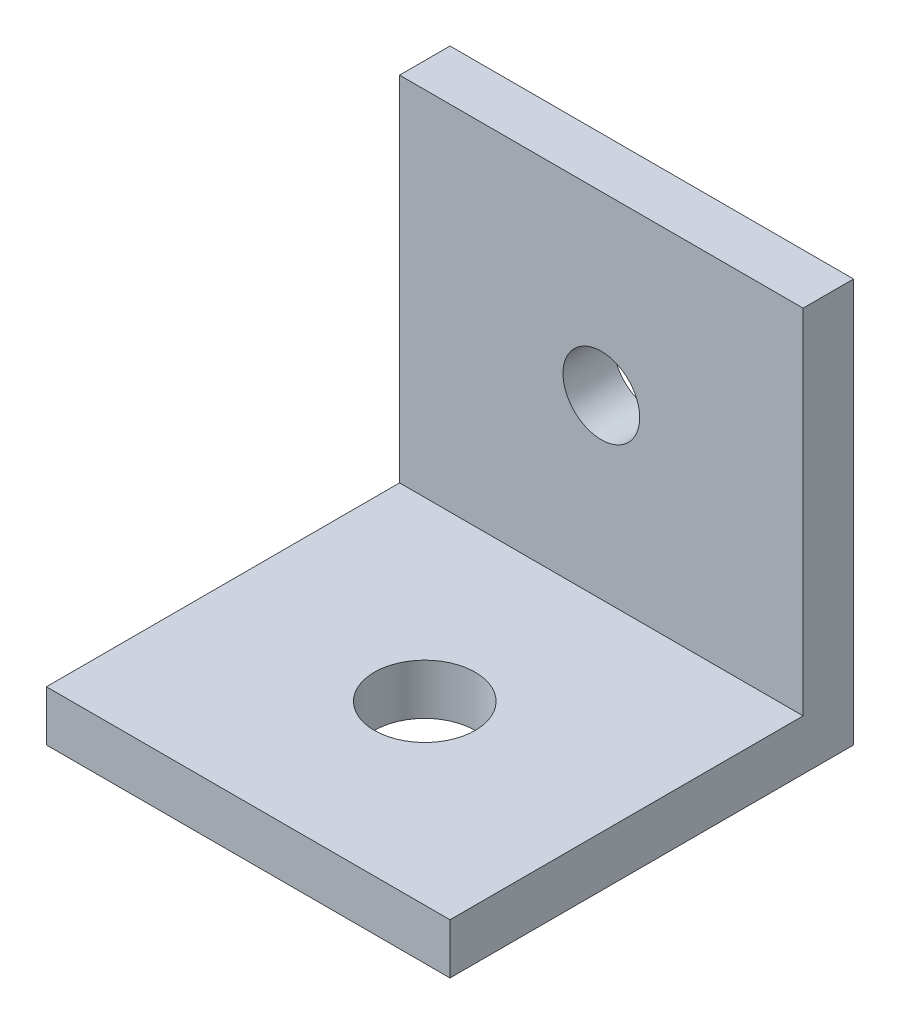
from build123d import *

# Parameters (mm, degrees)
SKETCH1_W           = 25.4
SKETCH1_H           = 25.4
BOSS_EXTRUDE1_DEPTH = 3.175
SKETCH6_W           = 25.4
SKETCH6_H           = 3.175
BOSS_EXTRUDE2_DEPTH = 22.225
SKETCH8_R           = 2.413
CUT_EXTRUDE3_DEPTH  = 3.175
SKETCH9_R           = 3.175
CUT_EXTRUDE4_DEPTH  = 3.175


with BuildPart() as part:
    # Sketch1 → Boss-Extrude1 (new body)
    with BuildSketch(Plane(origin=(0, 0, 0), x_dir=(1, 0, 0), z_dir=(0, 1, 0))):
        Rectangle(SKETCH1_W, SKETCH1_H)
    extrude(amount=BOSS_EXTRUDE1_DEPTH)

    # Sketch6 → Boss-Extrude2 (add)
    with BuildSketch(Plane(origin=(0, 3.175, 0), x_dir=(1, 0, 0), z_dir=(0, 1, 0))):
        with Locations((0, 11.1125)):
            Rectangle(SKETCH6_W, SKETCH6_H)
    extrude(amount=BOSS_EXTRUDE2_DEPTH)

    # Sketch8 → Cut-Extrude3 (cut)
    with BuildSketch(Plane.XY.offset(-9.525)):
        with Locations((0, 14.2875)):
            Circle(SKETCH8_R)
    extrude(amount=-CUT_EXTRUDE3_DEPTH, mode=Mode.SUBTRACT)

    # Sketch9 → Cut-Extrude4 (cut)
    with BuildSketch(Plane(origin=(0, 3.175, 0), x_dir=(1, 0, 0), z_dir=(0, 1, 0))):
        with Locations((0, -1.5875)):
            Circle(SKETCH9_R)
    extrude(amount=-CUT_EXTRUDE4_DEPTH, mode=Mode.SUBTRACT)


solid = part.part
